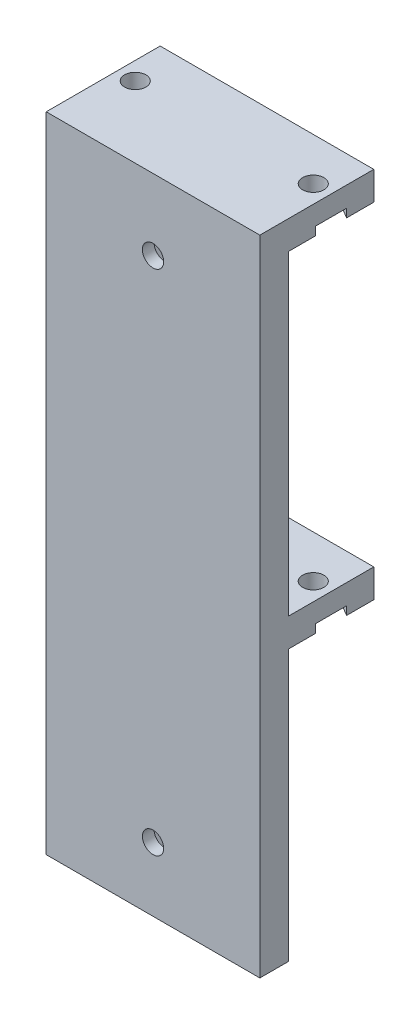
from build123d import *

# Parameters (mm, degrees)
EXTRU_MINCE1_START      = -19.05
EXTRU_MINCE1_DEPTH      = 38.1
ESQUISSE3_R             = 1.89865
ENL_V_MAT_EXTRU_2_DEPTH = 75.865138463
D_GAGEMENT_61_D         = 3.7973
ENL_V_MAT_EXTRU_3_DEPTH = 3
ENL_V_MAT_EXTRU_4_DEPTH = 1.5
ENL_V_MAT_EXTRU_5_DEPTH = 1.5


# Read off the part's stored shape, not the designer's step: Extru.-Mince1
with BuildPart() as part:
    # Extru.-Mince1 outline → Extru.-Mince1 (new body)
    with BuildSketch(Plane(origin=(0, 0, 0), x_dir=(0, 0, -1), z_dir=(1, 0, 0)).offset(EXTRU_MINCE1_START)):
        Polygon((20.32, -16.1508919), (5.08, -16.1508919), (5.08, 40.1736081), (20.32, 40.1736081), (20.32, 45.2536081), (0, 45.2536081), (0, -69.4908919), (5.08, -69.4908919), (5.08, -21.2308919), (20.32, -21.2308919), align=None)
    extrude(amount=EXTRU_MINCE1_DEPTH)

    # Esquisse3 → Enlèv. mat.-Extru.2 (cut, through all)
    with BuildSketch(Plane.XY):
        with Locations((0, -58.0608919)):
            Circle(ESQUISSE3_R)
        with Locations((0, 32.5536081)):
            Circle(ESQUISSE3_R)
    extrude(amount=-ENL_V_MAT_EXTRU_2_DEPTH, mode=Mode.SUBTRACT)

    # Dégagement #61 (through all)
    with Locations(Plane(origin=(0, -21.2308919, 0), x_dir=(-1, 0, 0), z_dir=(0, -1, 0))):
        with Locations((-15.875, 12.7), (15.875, 12.7)):
            Hole(D_GAGEMENT_61_D / 2)

    # Esquisse10 → Enlèv. mat.-Extru.3 (cut)
    with BuildSketch(Plane(origin=(0, 0, -5.08), x_dir=(-1, 0, 0), z_dir=(0, 0, -1))):
        Polygon((2.453738644, 36.8036081), (-2.453738644, 36.8036081), (-4.907477288, 32.5536081), (-2.453738644, 28.3036081), (2.453738644, 28.3036081), (4.907477288, 32.5536081), align=None)
        Polygon((2.453738644, -53.8108919), (-2.453738644, -53.8108919), (-4.907477288, -58.0608919), (-2.453738644, -62.3108919), (2.453738644, -62.3108919), (4.907477288, -58.0608919), align=None)
    extrude(amount=-ENL_V_MAT_EXTRU_3_DEPTH, mode=Mode.SUBTRACT)

    # Esquisse12 → Enlèv. mat.-Extru.4 (cut)
    with BuildSketch(Plane.XZ.offset(21.2308919)):
        Polygon((11.875, -10.390598923), (11.875, -15.009401077), (15.875, -17.318802154), (19.875, -15.009401077), (19.875, -10.390598923), (15.875, -8.081197846), align=None)
        Polygon((-19.875, -10.390598923), (-19.875, -15.009401077), (-15.875, -17.318802154), (-11.875, -15.009401077), (-11.875, -10.390598923), (-15.875, -8.081197846), align=None)
    extrude(amount=-ENL_V_MAT_EXTRU_4_DEPTH, mode=Mode.SUBTRACT)

    # Esquisse13 → Enlèv. mat.-Extru.5 (cut)
    with BuildSketch(Plane.XZ.offset(-40.1736081)):
        Polygon((-11.875, -15.009401077), (-11.875, -10.390598923), (-15.875, -8.081197846), (-19.875, -10.390598923), (-19.875, -15.009401077), (-15.875, -17.318802154), align=None)
        Polygon((15.875, -8.081197846), (11.875, -10.390598923), (11.875, -15.009401077), (15.875, -17.318802154), (19.875, -15.009401077), (19.875, -10.390598923), align=None)
    extrude(amount=-ENL_V_MAT_EXTRU_5_DEPTH, mode=Mode.SUBTRACT)


solid = part.part
